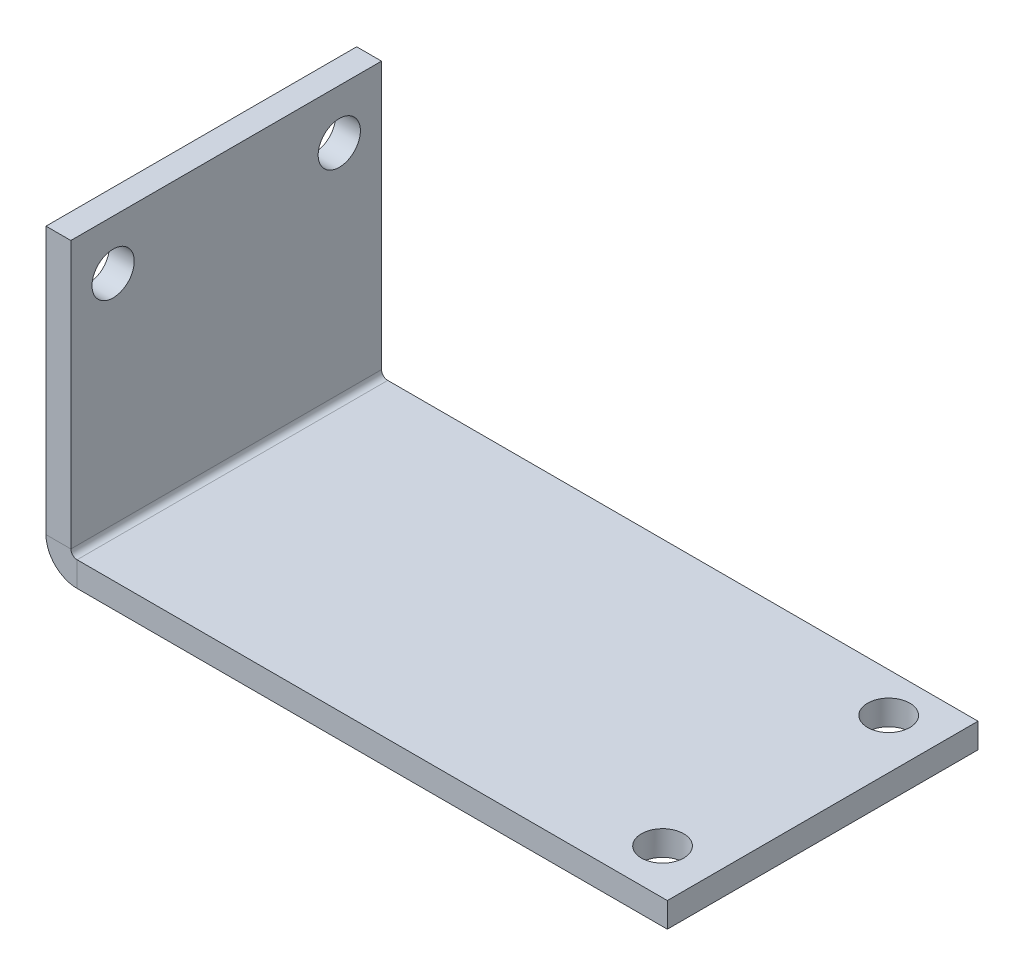
from build123d import *

# Parameters (mm, degrees)
SM_BASE_FLANGE_1_DEPTH = 25
SKETCH_6_R             = 1.7
CUT_EXTRUDE_1_DEPTH    = 10
SKETCH_7_R             = 1.7
CUT_EXTRUDE_2_DEPTH    = 10


# Sheet-metal steps are written as plain solids
with BuildPart() as part:
    # Sketch 1 → 基体-法兰1 (new body)
    with BuildSketch(Plane.XY):
        with BuildLine():
            Line((0, 24), (0, 2.5))
            ThreePointArc((0, 2.5), (0.732233047, 0.732233047), (2.5, 0))
            Line((2.5, 0), (50, 0))
            Line((50, 0), (50, 2))
            Line((50, 2), (2.5, 2))
            ThreePointArc((2.5, 2), (2.146446609, 2.146446609), (2, 2.5))
            Line((2, 2.5), (2, 24))
            Line((2, 24), (0, 24))
        make_face()
    extrude(amount=SM_BASE_FLANGE_1_DEPTH)

    # 草图6 → 切除-拉伸1 (cut)
    with BuildSketch(Plane(origin=(2, 0, 0), x_dir=(0, 0, -1), z_dir=(1, 0, 0))):
        with Locations((-3.4, 20)):
            Circle(SKETCH_6_R)
        with Locations((-21.6, 20)):
            Circle(SKETCH_6_R)
    extrude(amount=-CUT_EXTRUDE_1_DEPTH, mode=Mode.SUBTRACT)

    # 草图7 → 切除-拉伸2 (cut)
    with BuildSketch(Plane(origin=(0, 2, 0), x_dir=(1, 0, 0), z_dir=(0, 1, 0))):
        with Locations(Location((46, -3.184253604, 0), (0, 0, 270))):
            Circle(SKETCH_7_R)
        with Locations(Location((46, -21.384253604, 0), (0, 0, 270))):
            Circle(SKETCH_7_R)
    extrude(amount=-CUT_EXTRUDE_2_DEPTH, mode=Mode.SUBTRACT)


solid = part.part
